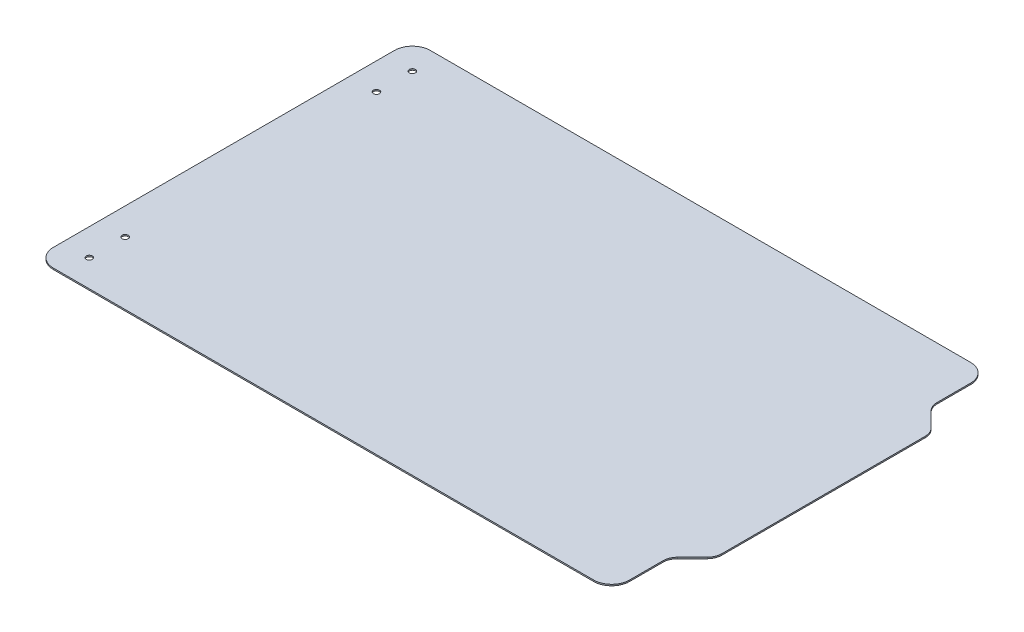
from build123d import *

# Parameters (mm, degrees)
SKETCH1_W           = 334
SKETCH1_H           = 210
BOSS_EXTRUDE1_DEPTH = 0.76
CUT_EXTRUDE1_DEPTH  = 0.76
FILLET1_R           = 8
FILLET2_R           = 10
SKETCH3_R           = 1.7
CUT_EXTRUDE2_DEPTH  = 198.267781455


with BuildPart() as part:
    # Sketch1 → Boss-Extrude1 (new body)
    with BuildSketch(Plane(origin=(0, 0, 0), x_dir=(1, 0, 0), z_dir=(0, 1, 0))):
        Rectangle(SKETCH1_W, SKETCH1_H)
    extrude(amount=BOSS_EXTRUDE1_DEPTH)

    # Sketch2 → Cut-Extrude1 (cut)
    with BuildSketch(Plane(origin=(0, 0, 0), x_dir=(-1, 0, 0), z_dir=(0, -1, 0))):
        Polygon((-167, -60), (-154, -73), (-154, -105), (-167, -105), align=None)
        Polygon((-154, 105), (-167, 105), (-167, 60), (-154, 73), align=None)
    extrude(amount=-CUT_EXTRUDE1_DEPTH, mode=Mode.SUBTRACT)

    # Fillet1
    fillet1_edges = [part.edges().sort_by_distance(p)[0] for p in [
        (154, 0.38, -73),
        (167, 0.38, -60),
        (154, 0.38, 73),
        (167, 0.38, 60),
    ]]
    fillet(fillet1_edges, radius=FILLET1_R)

    # Fillet2
    fillet2_edges = [part.edges().sort_by_distance(p)[0] for p in [
        (154, 0.38, -105),
        (-167, 0.38, -105),
        (-167, 0.38, 105),
        (154, 0.38, 105),
    ]]
    fillet(fillet2_edges, radius=FILLET2_R)

    # Sketch3 → Cut-Extrude2 (cut, through all)
    with BuildSketch(Plane.XZ):
        with Locations((-152, -70)):
            Circle(SKETCH3_R)
        with Locations((-152, -90)):
            Circle(SKETCH3_R)
        with Locations((-152, 70)):
            Circle(SKETCH3_R)
        with Locations((-152, 90)):
            Circle(SKETCH3_R)
    extrude(amount=-CUT_EXTRUDE2_DEPTH, mode=Mode.SUBTRACT)


solid = part.part
